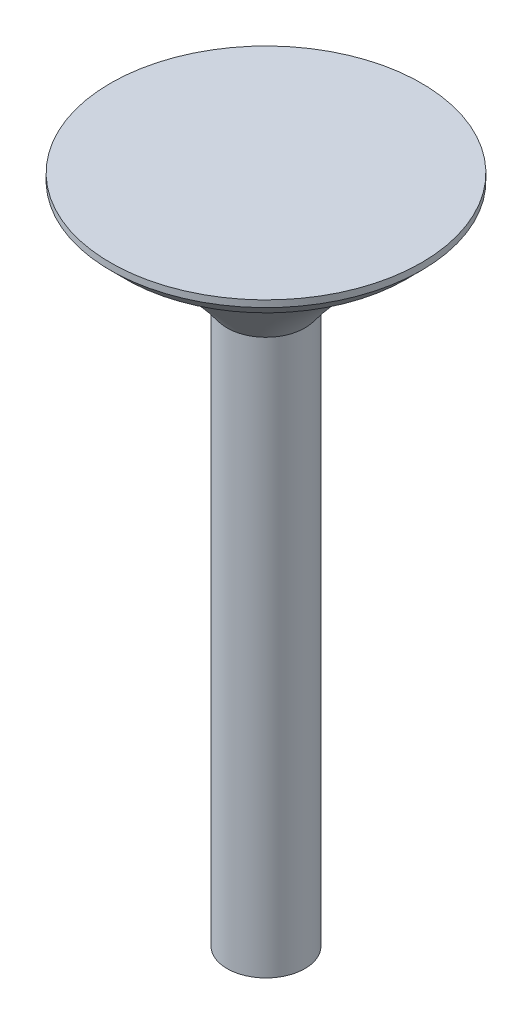
from build123d import *


with BuildPart() as part:
    # Sketch1 → Revolve1 (revolve)
    with BuildSketch(Plane.XY):
        with BuildLine():
            Line((0, 105.721798884), (-23.22, 105.721798884))
            Line((-23.22, 105.721798884), (-23.22, 104.721798884))
            Line((-23.22, 104.721798884), (-20.898, 102.399798884))
            ThreePointArc((-20.898, 102.399798884), (-12.636135495, 96.265492773), (-5.805, 88.569798884))
            Line((-5.805, 88.569798884), (-5.805, 5.721798884))
            Line((-5.805, 5.721798884), (0, 5.721798884))
            Line((0, 5.721798884), (0, 105.721798884))
        make_face()
    revolve(axis=Axis((0, 105.721798884, 0), (0, -1, 0)))


solid = part.part
